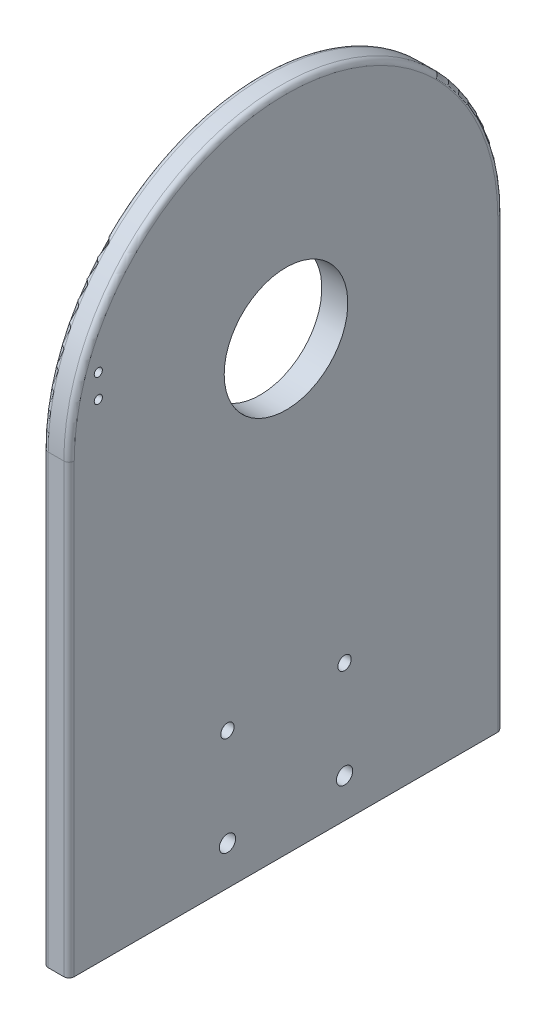
from build123d import *

# Parameters (mm, degrees)
SKETCH_1_W                   = 40
SKETCH_1_H                   = 66.7
EXTRUDE_1_DEPTH              = 2
SKETCH_2_W                   = 4
SKETCH_2_H                   = 66.7
EXTRUDE_2_DEPTH              = 100
CUT_EXTRUDE_1_DEPTH          = 115.526077816
CUT_EXTRUDE_1_DEPTH_BACK     = 115.526077816
HOLE_WIZARD_M4_1_D           = 3.3
HOLE_WIZARD_M4_1_CSINK_D     = 4.05
HOLE_WIZARD_M4_1_CSINK_ANGLE = 90
HOLE_WIZARD_M4_2_AT_2_COUNT  = 2
HOLE_WIZARD_M4_2_AT_2_PITCH  = 68.59294731
HOLE_WIZARD_M4_2_AT_3_COUNT  = 2
HOLE_WIZARD_M4_2_AT_3_PITCH  = 26
HOLE_WIZARD_M4_2_AT_4_COUNT  = 2
HOLE_WIZARD_M4_2_AT_4_PITCH  = 62.376998966
HOLE_WIZARD_M4_2_AT_5_COUNT  = 2
HOLE_WIZARD_M4_2_AT_5_PITCH  = 56.7
SKETCH_11_W                  = 66.7
SKETCH_11_H                  = 2
EXTRUDE_3_DEPTH              = 100
SKETCH_13_W                  = 40
SKETCH_13_H                  = 66.7
EXTRUDE_4_DEPTH              = 2
SKETCH_14_W                  = 4
SKETCH_14_H                  = 66.7
EXTRUDE_5_DEPTH              = 100
CUT_EXTRUDE_2_DEPTH          = 180.589037806
CUT_EXTRUDE_2_DEPTH_BACK     = 180.589037806
HOLE_WIZARD_M4_3_AT_2_COUNT  = 2
HOLE_WIZARD_M4_3_AT_2_PITCH  = 26
HOLE_WIZARD_M4_3_AT_3_COUNT  = 2
HOLE_WIZARD_M4_3_AT_3_PITCH  = 62.376998966
HOLE_WIZARD_M4_3_AT_4_COUNT  = 2
HOLE_WIZARD_M4_3_AT_4_PITCH  = 56.7
CUT_EXTRUDE_3_REACH          = 181.589
SKETCH_18_R                  = 9.5
CUT_EXTRUDE_4_REACH          = 181.589
SKETCH_21_R                  = 11
CUT_EXTRUDE_5_REACH          = 181.589
SKETCH_22_R                  = 4.5
FILLET_1_R                   = 2
CUT_EXTRUDE_6_REACH          = 193.604
SKETCH_23_W                  = 36
SKETCH_23_H                  = 66.7
CUT_EXTRUDE_7_REACH          = 164.752
SKETCH_24_W                  = 36
SKETCH_24_H                  = 66.7
HOLE_WIZARD_M3_1_D           = 2.5
HOLE_WIZARD_M3_1_CSINK_D     = 3.05
HOLE_WIZARD_M3_1_CSINK_ANGLE = 90
CUT_EXTRUDE_8_DEPTH          = 154.990981879
CUT_EXTRUDE_8_DEPTH_BACK     = 154.990981879
SKETCH_27_W                  = 104
SKETCH_27_H                  = 66.7
FILLET_2_R                   = 0.8


# Read off the part's stored shape, not the designer's step: M2.5 螺纹孔1, M1.6 螺纹孔1
with BuildPart() as part:
    # 草图1 → 凸台-拉伸1 (new body)
    with BuildSketch(Plane(origin=(0, 0, 0), x_dir=(1, 0, 0), z_dir=(0, 1, 0))):
        Rectangle(SKETCH_1_W, SKETCH_1_H)
    extrude(amount=EXTRUDE_1_DEPTH)

    # 草图2 → 凸台-拉伸2 (add)
    with BuildSketch(Plane(origin=(0, 2, 0), x_dir=(1, 0, 0), z_dir=(0, 1, 0))):
        with Locations((-18, 0)):
            Rectangle(SKETCH_2_W, SKETCH_2_H)
    extrude(amount=EXTRUDE_2_DEPTH)

    # 草图5 → 切除-拉伸1 (cut, two sides: drawn at the far end of the back side and taken through both)
    with BuildSketch(Plane.ZY.offset(20).offset(-CUT_EXTRUDE_1_DEPTH_BACK)):
        with BuildLine():
            ThreePointArc((0, 102), (23.582011153, 92.232011153), (33.35, 68.65))
            Line((33.35, 68.65), (33.35, 102))
            Line((33.35, 102), (0, 102))
        make_face()
        with BuildLine():
            ThreePointArc((-33.35, 68.65), (-23.582011153, 92.232011153), (0, 102))
            Line((0, 102), (-33.35, 102))
            Line((-33.35, 102), (-33.35, 68.65))
        make_face()
    extrude(amount=CUT_EXTRUDE_1_DEPTH + CUT_EXTRUDE_1_DEPTH_BACK, mode=Mode.SUBTRACT)

    # M4 螺纹孔1 (through all)
    with Locations(Plane.ZY.offset(20)):
        with Locations((0, 97.65), (25.11473671, 54.15), (-25.11473671, 54.15)):
            CounterSinkHole(HOLE_WIZARD_M4_1_D / 2, HOLE_WIZARD_M4_1_CSINK_D / 2, counter_sink_angle=HOLE_WIZARD_M4_1_CSINK_ANGLE)

    # 草图10 → M4 螺纹孔2 (revolve, cut)
    with BuildSketch(Plane(origin=(15, 2, -28.35), x_dir=(0, 0, 1), z_dir=(1, 0, 0))):
        Polygon((0, 0), (0, 2), (1.65, 2), (1.65, 0.375), (2.025, 0), align=None)
    hole_wizard_m4_2 = revolve(axis=Axis((15, 8.35, -28.35), (0, -1, 0)), mode=Mode.SUBTRACT)

    # M4 螺纹孔2 at 2: M4 螺纹孔2 ×2
    with Locations(*[Vector(-0.9508085645250022, 0, 0.3097790722852413) * (i * HOLE_WIZARD_M4_2_AT_2_PITCH) for i in range(1, HOLE_WIZARD_M4_2_AT_2_COUNT)]):
        add(hole_wizard_m4_2, mode=Mode.SUBTRACT)

    # M4 螺纹孔2 at 3: M4 螺纹孔2 ×2
    with Locations(*[(-i * HOLE_WIZARD_M4_2_AT_3_PITCH, 0, 0) for i in range(1, HOLE_WIZARD_M4_2_AT_3_COUNT)]):
        add(hole_wizard_m4_2, mode=Mode.SUBTRACT)

    # M4 螺纹孔2 at 4: M4 螺纹孔2 ×2
    with Locations(*[Vector(-0.4168203092647413, 0, 0.9089889052042635) * (i * HOLE_WIZARD_M4_2_AT_4_PITCH) for i in range(1, HOLE_WIZARD_M4_2_AT_4_COUNT)]):
        add(hole_wizard_m4_2, mode=Mode.SUBTRACT)

    # M4 螺纹孔2 at 5: M4 螺纹孔2 ×2
    with Locations(*[(0, 0, i * HOLE_WIZARD_M4_2_AT_5_PITCH) for i in range(1, HOLE_WIZARD_M4_2_AT_5_COUNT)]):
        add(hole_wizard_m4_2, mode=Mode.SUBTRACT)

    # 草图11 → 凸台-拉伸3 (add)
    with BuildSketch(Plane.ZY.offset(20)):
        with Locations((0, 16)):
            Rectangle(SKETCH_11_W, SKETCH_11_H)
    extrude(amount=EXTRUDE_3_DEPTH)



with BuildPart() as body_2:
    # 草图13 → 凸台-拉伸4 (new body)
    with BuildSketch(Plane(origin=(0, 0, 0), x_dir=(1, 0, 0), z_dir=(0, 1, 0))):
        with Locations((-140, 0)):
            Rectangle(SKETCH_13_W, SKETCH_13_H)
    extrude(amount=EXTRUDE_4_DEPTH)


with BuildPart() as part_1:
    add(part.part)

    add(body_2.part)  # 凸台-拉伸5 merges body 2
    # 草图14 → 凸台-拉伸5 (add)
    with BuildSketch(Plane(origin=(0, 2, 0), x_dir=(1, 0, 0), z_dir=(0, 1, 0))):
        with Locations((-122, 0)):
            Rectangle(SKETCH_14_W, SKETCH_14_H)
    extrude(amount=EXTRUDE_5_DEPTH)

    # 草图15 → 切除-拉伸2 (cut, two sides: drawn at the far end of the back side and taken through both)
    with BuildSketch(Plane.ZY.offset(124).offset(-CUT_EXTRUDE_2_DEPTH_BACK)):
        with BuildLine():
            ThreePointArc((0, 102), (23.582011153, 92.232011153), (33.35, 68.65))
            Line((33.35, 68.65), (33.35, 102))
            Line((33.35, 102), (0, 102))
        make_face()
        with BuildLine():
            ThreePointArc((-33.35, 68.65), (-23.582011153, 92.232011153), (0, 102))
            Line((0, 102), (-33.35, 102))
            Line((-33.35, 102), (-33.35, 68.65))
        make_face()
    extrude(amount=CUT_EXTRUDE_2_DEPTH + CUT_EXTRUDE_2_DEPTH_BACK, mode=Mode.SUBTRACT)

    # 草图17 → M4 螺纹孔3 (revolve, cut)
    with BuildSketch(Plane(origin=(-129, 2, -28.35), x_dir=(0, 0, 1), z_dir=(1, 0, 0))):
        Polygon((0, 0), (0, 2), (1.65, 2), (1.65, 0.375), (2.025, 0), align=None)
    hole_wizard_m4_3 = revolve(axis=Axis((-129, 8.35, -28.35), (0, -1, 0)), mode=Mode.SUBTRACT)

    # M4 螺纹孔3 at 2: M4 螺纹孔3 ×2
    with Locations(*[(-i * HOLE_WIZARD_M4_3_AT_2_PITCH, 0, 0) for i in range(1, HOLE_WIZARD_M4_3_AT_2_COUNT)]):
        add(hole_wizard_m4_3, mode=Mode.SUBTRACT)

    # M4 螺纹孔3 at 3: M4 螺纹孔3 ×2
    with Locations(*[Vector(-0.41682030926474106, 0, 0.9089889052042636) * (i * HOLE_WIZARD_M4_3_AT_3_PITCH) for i in range(1, HOLE_WIZARD_M4_3_AT_3_COUNT)]):
        add(hole_wizard_m4_3, mode=Mode.SUBTRACT)

    # M4 螺纹孔3 at 4: M4 螺纹孔3 ×2
    with Locations(*[(0, 0, i * HOLE_WIZARD_M4_3_AT_4_PITCH) for i in range(1, HOLE_WIZARD_M4_3_AT_4_COUNT)]):
        add(hole_wizard_m4_3, mode=Mode.SUBTRACT)

    # 草图18 → 切除-拉伸3 (cut, up to next)
    with BuildSketch(Plane.ZY.offset(124), mode=Mode.PRIVATE) as cut_extrude_3_sk1:
        with Locations((0, 68.65)):
            Circle(SKETCH_18_R)
    cut_extrude_3_tool1 = extrude(cut_extrude_3_sk1.sketch, amount=-CUT_EXTRUDE_3_REACH, mode=Mode.PRIVATE) & part_1.part
    add(cut_extrude_3_tool1.solids().sort_by_distance((-124, 68.65, 0))[0], mode=Mode.SUBTRACT)

    # 草图21 → 切除-拉伸4 (cut, up to next)
    with BuildSketch(Plane(origin=(-16, 0, 0), x_dir=(0, 0, -1), z_dir=(1, 0, 0)), mode=Mode.PRIVATE) as cut_extrude_4_sk1:
        with Locations((0, 68.65)):
            Circle(SKETCH_21_R)
    cut_extrude_4_tool1 = extrude(cut_extrude_4_sk1.sketch, amount=-CUT_EXTRUDE_4_REACH, mode=Mode.PRIVATE) & part_1.part
    add(cut_extrude_4_tool1.solids().sort_by_distance((-16, 68.65, 0))[0], mode=Mode.SUBTRACT)

    # 草图22 → 切除-拉伸5 (cut, up to next)
    with BuildSketch(Plane(origin=(-16, 0, 0), x_dir=(0, 0, -1), z_dir=(1, 0, 0)), mode=Mode.PRIVATE) as cut_extrude_5_sk1:
        with Locations((16.670989023, 59.025)):
            Circle(SKETCH_22_R)
    cut_extrude_5_tool1 = extrude(cut_extrude_5_sk1.sketch, amount=-CUT_EXTRUDE_5_REACH, mode=Mode.PRIVATE) & part_1.part
    add(cut_extrude_5_tool1.solids().sort_by_distance((-16, 59.025, -16.670989))[0], mode=Mode.SUBTRACT)

    # 圆角1
    fillet_1_edges = [part_1.edges().sort_by_distance(p)[0] for p in [
        (-160, 1, -33.35),
        (-160, 1, 33.35),
        (20, 1, 33.35),
        (20, 1, -33.35),
    ]]
    fillet(fillet_1_edges, radius=FILLET_1_R)

    # 草图23 → 切除-拉伸6 (cut, up to next)
    with BuildSketch(Plane(origin=(0, 2, 0), x_dir=(1, 0, 0), z_dir=(0, 1, 0)), mode=Mode.PRIVATE) as cut_extrude_6_sk1:
        with Locations((-142, 0)):
            Rectangle(SKETCH_23_W, SKETCH_23_H)
    cut_extrude_6_tool1 = extrude(cut_extrude_6_sk1.sketch, amount=-CUT_EXTRUDE_6_REACH, mode=Mode.PRIVATE) & part_1.part
    add(cut_extrude_6_tool1.solids().sort_by_distance((-142, 2, 0))[0], mode=Mode.SUBTRACT)

    # 草图24 → 切除-拉伸7 (cut, up to next)
    with BuildSketch(Plane(origin=(0, 2, 0), x_dir=(1, 0, 0), z_dir=(0, 1, 0)), mode=Mode.PRIVATE) as cut_extrude_7_sk1:
        with Locations((2, 0)):
            Rectangle(SKETCH_24_W, SKETCH_24_H)
    cut_extrude_7_tool1 = extrude(cut_extrude_7_sk1.sketch, amount=-CUT_EXTRUDE_7_REACH, mode=Mode.PRIVATE) & part_1.part
    add(cut_extrude_7_tool1.solids().sort_by_distance((2, 2, 0))[0], mode=Mode.SUBTRACT)

    # M3 螺纹孔1 (through all)
    with Locations(Plane(origin=(-16, 0, 0), x_dir=(0, 0, -1), z_dir=(1, 0, 0))):
        with Locations((9, 6), (-9, 6)):
            CounterSinkHole(HOLE_WIZARD_M3_1_D / 2, HOLE_WIZARD_M3_1_CSINK_D / 2, counter_sink_angle=HOLE_WIZARD_M3_1_CSINK_ANGLE)

    # 草图27 → 切除-拉伸8 (cut, two sides: drawn at the far end of the back side and taken through both)
    with BuildSketch(Plane(origin=(0, 17, 0), x_dir=(1, 0, 0), z_dir=(0, 1, 0)).offset(-CUT_EXTRUDE_8_DEPTH_BACK)):
        with Locations((-68, 0)):
            Rectangle(SKETCH_27_W, SKETCH_27_H)
    extrude(amount=CUT_EXTRUDE_8_DEPTH + CUT_EXTRUDE_8_DEPTH_BACK, mode=Mode.SUBTRACT)

    # M2.5 螺纹孔1 outline → M2.5 螺纹孔1 (revolve, cut)
    with BuildSketch(Plane(origin=(0, 21, -9), x_dir=(0, 1, 0), z_dir=(0, 0, -1))):
        Polygon((1.025, -123.75), (1.025, -120), (0, -120), (0, -124), (1.275, -124), align=None)
    revolve(axis=Axis((0, 21, -9), (1, 0, 0)), mode=Mode.SUBTRACT)

    # Hole Wizard M2.5 _1 2 outline → Hole Wizard M2.5 _1 2 (revolve, cut)
    with BuildSketch(Plane(origin=(0, 21, 9), x_dir=(0, 1, 0), z_dir=(0, 0, -1))):
        Polygon((1.025, -123.75), (1.025, -120), (0, -120), (0, -124), (1.275, -124), align=None)
    revolve(axis=Axis((0, 21, 9), (1, 0, 0)), mode=Mode.SUBTRACT)

    # 圆角2
    fillet_2_edges = [part_1.edges().sort_by_distance(p)[0] for p in [
        (-120, 34.325, 33.35),
        (-120, 34.325, -33.35),
        (-122, 0, -33.35),
        (-124, 34.325, -33.35),
        (-120, 102, 0),
        (-124, 102, 0),
        (-124, 34.325, 33.35),
    ]]
    fillet(fillet_2_edges, radius=FILLET_2_R)

    # M1.6 螺纹孔1 outline → M1.6 螺纹孔1 (revolve, cut)
    with BuildSketch(Plane(origin=(0, 75, 28.85), x_dir=(0, 1, 0), z_dir=(0, 0, -1))):
        Polygon((0.625, -123.8), (0.625, -120), (0, -120), (0, -124), (0.825, -124), align=None)
    revolve(axis=Axis((0, 75, 28.85), (1, 0, 0)), mode=Mode.SUBTRACT)

    # Hole Wizard M1.6 _1 2 outline → Hole Wizard M1.6 _1 2 (revolve, cut)
    with BuildSketch(Plane(origin=(0, 78.6, 28.85), x_dir=(0, 1, 0), z_dir=(0, 0, -1))):
        Polygon((0.625, -123.8), (0.625, -120), (0, -120), (0, -124), (0.825, -124), align=None)
    revolve(axis=Axis((0, 78.6, 28.85), (1, 0, 0)), mode=Mode.SUBTRACT)


solid = part_1.part
